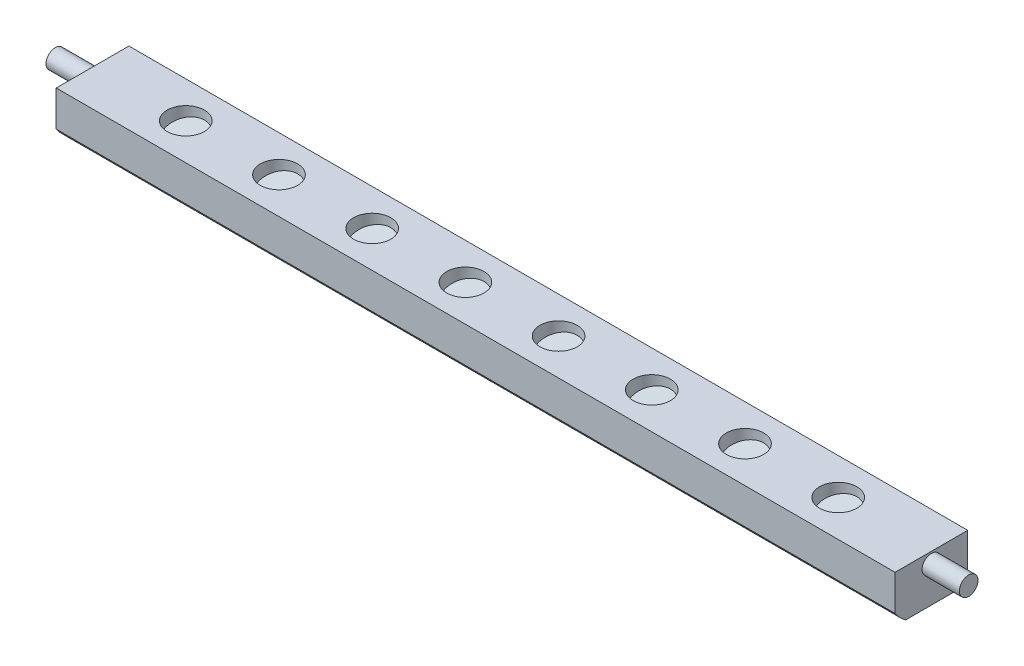
from build123d import *

# Parameters (mm, degrees)
SKETCH1_W                       = 450
SKETCH1_H                       = 20
BOSS_EXTRUDE1_DEPTH             = 14
SKETCH2_R                       = 10
CUT_EXTRUDE1_DEPTH              = 10
LPATTERN1_COUNT                 = 8
LPATTERN1_PITCH                 = 50
SKETCH3_R                       = 5
BOSS_EXTRUDE2_DEPTH             = 20
FILLET1_R                       = 14
BOSS_EXTRUDE3_REACH             = 472.315
BOSS_EXTRUDE4_REACH             = 247.603
BOSS_EXTRUDE4_DIRECTION_2_REACH = 247.603


with BuildPart() as part:
    # Sketch1 → Boss-Extrude1 (new, symmetric)
    with BuildSketch(Plane.XY):
        Rectangle(SKETCH1_W, SKETCH1_H)
    extrude(amount=BOSS_EXTRUDE1_DEPTH, both=True)

    # Sketch2 → Cut-Extrude1 (cut)
    with BuildSketch(Plane(origin=(0, 10, 0), x_dir=(1, 0, 0), z_dir=(0, 1, 0))):
        with Locations(Location((-175, 0, 0), (0, 0, 180))):
            Circle(SKETCH2_R)
    cut_extrude1 = extrude(amount=-CUT_EXTRUDE1_DEPTH, mode=Mode.SUBTRACT)

    # LPattern1: Cut-Extrude1 ×8
    with Locations(*[(i * LPATTERN1_PITCH, 0, 0) for i in range(1, LPATTERN1_COUNT)]):
        add(cut_extrude1, mode=Mode.SUBTRACT)

    # Sketch3 → Boss-Extrude2 (add)
    with BuildSketch(Plane(origin=(225, 0, 0), x_dir=(0, 0, -1), z_dir=(1, 0, 0))):
        with Locations((0, 4)):
            Circle(SKETCH3_R)
    boss_extrude2 = extrude(amount=BOSS_EXTRUDE2_DEPTH)

    # Mirror1: Boss-Extrude2 across plane
    add(boss_extrude2.mirror(Plane(origin=(0, 0, 0), x_dir=(0, 0, 1), z_dir=(1, 0, 0))))

    # Fillet1
    fillet1_edges = [part.edges().sort_by_distance(p)[0] for p in [
        (0, -10, 14),
        (0, -10, -14),
    ]]
    fillet(fillet1_edges, radius=FILLET1_R - 0.0001)  # a hair under: the kernel refuses the full size

    # Boss-Extrude3: up to this face of the body (flat: up to its plane)
    boss_extrude3_end = Plane(part.part.faces().sort_by_distance((225, 6.99995, -13.655906989))[0])
    # Sketch5 → Boss-Extrude3 (add, up to the picked face)
    with BuildSketch(Plane.ZY.offset(225), mode=Mode.PRIVATE) as boss_extrude3_sk1:
        Polygon((10, 0), (-10, 0), (-10, 5.358983849), align=None)
    boss_extrude3_tool1 = split(extrude(boss_extrude3_sk1.sketch, amount=-BOSS_EXTRUDE3_REACH, mode=Mode.PRIVATE), bisect_by=boss_extrude3_end, keep=Keep.BOTH, mode=Mode.PRIVATE)
    add(boss_extrude3_tool1.solids().sort_by(Axis((-225, 1.786328, -3.333333), (1, 0, 0)))[0])

    # Boss-Extrude4: up to this face of the body (flat: up to its plane)
    boss_extrude4_end = Plane(part.part.faces().sort_by_distance((-225, 6.99995, -13.655906989))[0])
    # Sketch6 → Boss-Extrude4 (add, up to the picked face)
    with BuildSketch(Plane(origin=(0, 0, 0), x_dir=(0, 0, -1), z_dir=(1, 0, 0)), mode=Mode.PRIVATE) as boss_extrude4_sk1:
        with BuildLine():
            Line((-19.5, 10), (-14, 10))
            Line((-14, 10), (-14, 4))
            ThreePointArc((-14, 4), (-9.899494937, -5.899494937), (0, -10))
            ThreePointArc((0, -10), (9.899494937, -5.899494937), (14, 4))
            Line((14, 4), (14, 10))
            Line((14, 10), (19.5, 10))
            Line((19.5, 10), (19.5, -15))
            Line((19.5, -15), (-13.829316686, -15))
            ThreePointArc((-13.829316686, -15), (-16.922455665, -12.305842336), (-19.5, -9.114877049))
            Line((-19.5, -9.114877049), (-19.5, 10))
        make_face()
    boss_extrude4_tool1 = split(extrude(boss_extrude4_sk1.sketch, amount=-BOSS_EXTRUDE4_REACH, mode=Mode.PRIVATE), bisect_by=boss_extrude4_end, keep=Keep.BOTH, mode=Mode.PRIVATE)
    add(boss_extrude4_tool1.solids().sort_by(Axis((0, 0.442561, 19.036751), (-1, 0, 0)))[0])

    # Boss-Extrude4 direction 2: up to this face of the body (flat: up to its plane)
    boss_extrude4_direction_2_end = Plane(part.part.faces().sort_by_distance((225, 6.99995, -13.655906989))[0])
    # Sketch6 → Boss-Extrude4 direction 2 (add, up to the picked face)
    with BuildSketch(Plane(origin=(0, 0, 0), x_dir=(0, 0, -1), z_dir=(1, 0, 0)), mode=Mode.PRIVATE) as boss_extrude4_direction_2_sk1:
        with BuildLine():
            Line((-19.5, 10), (-14, 10))
            Line((-14, 10), (-14, 4))
            ThreePointArc((-14, 4), (-9.899494937, -5.899494937), (0, -10))
            ThreePointArc((0, -10), (9.899494937, -5.899494937), (14, 4))
            Line((14, 4), (14, 10))
            Line((14, 10), (19.5, 10))
            Line((19.5, 10), (19.5, -15))
            Line((19.5, -15), (-13.829316686, -15))
            ThreePointArc((-13.829316686, -15), (-16.922455665, -12.305842336), (-19.5, -9.114877049))
            Line((-19.5, -9.114877049), (-19.5, 10))
        make_face()
    boss_extrude4_direction_2_tool1 = split(extrude(boss_extrude4_direction_2_sk1.sketch, amount=BOSS_EXTRUDE4_DIRECTION_2_REACH, mode=Mode.PRIVATE), bisect_by=boss_extrude4_direction_2_end, keep=Keep.BOTH, mode=Mode.PRIVATE)
    add(boss_extrude4_direction_2_tool1.solids().sort_by(Axis((0, 0.442561, 19.036751), (1, 0, 0)))[0])


solid = part.part
